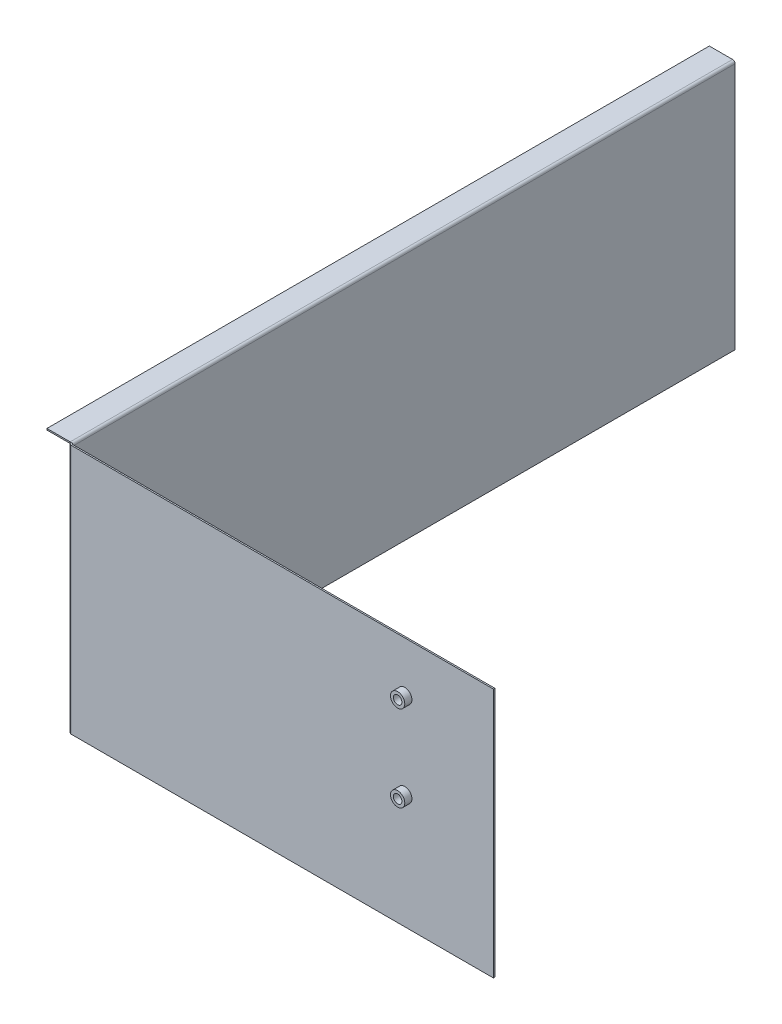
from build123d import *

# Parameters (mm, degrees)
SKETCH1_W                    = 297
SKETCH1_H                    = 175
BASE_FLANGE1_DEPTH           = 1
EDGE_FLANGE1_STRIP_W         = 5.4732
EDGE_FLANGE1_STRIP_H         = 1
EDGE_FLANGE1_STRIP_CUT_DEPTH = 175
EDGE_FLANGE1_DEPTH           = 175
EDGE_FLANGE2_STRIP_W         = 5.4732
EDGE_FLANGE2_STRIP_H         = 1
EDGE_FLANGE2_STRIP_CUT_DEPTH = 463.2634
EDGE_FLANGE2_DEPTH           = 463.2634
SKETCH17_R                   = 4.794
SKETCH17_R_2                 = 2.794
BOSS_EXTRUDE1_DEPTH          = 18
SKETCH21_R                   = 5
SKETCH21_R_2                 = 3
BOSS_EXTRUDE2_DEPTH          = 5


# Sheet-metal steps are written as plain solids
with BuildPart() as part:
    # Sketch1 → Base-Flange1 (new body)
    with BuildSketch(Plane.XY):
        Rectangle(SKETCH1_W, SKETCH1_H)
    extrude(amount=-BASE_FLANGE1_DEPTH)

    # Edge-Flange1 strip (across the edge) → Edge-Flange1 strip cut (cut)
    with BuildSketch(Plane(origin=(-148.5, -87.5, -1), x_dir=(1, 0, 0), z_dir=(0, 1, 0))):
        with Locations((-1, -0.5)):
            Rectangle(EDGE_FLANGE1_STRIP_W, EDGE_FLANGE1_STRIP_H)
    extrude(amount=EDGE_FLANGE1_STRIP_CUT_DEPTH, mode=Mode.SUBTRACT)

    # Edge-Flange1 section (across the edge) → Edge-Flange1 (add)
    with BuildSketch(Plane(origin=(-148.5, -87.5, -1), x_dir=(1, 0, 0), z_dir=(0, 1, 0))):
        with BuildLine():
            Line((0, 0.7366), (0, 464))
            Line((0, 464), (1, 464))
            Line((1, 464), (1, 0.7366))
            ThreePointArc((1, 0.7366), (1.215745145, 0.215745145), (1.7366, 0))
            Line((1.7366, 0), (1.7366, -1))
            ThreePointArc((1.7366, -1), (0.508638364, -0.491361636), (0, 0.7366))
        make_face()
    extrude(amount=EDGE_FLANGE1_DEPTH)

    # Edge-Flange2 strip (across the edge) → Edge-Flange2 strip cut (cut)
    with BuildSketch(Plane(origin=(-148.5, 87.5, -1.7366), x_dir=(0, -1, 0), z_dir=(0, 0, -1))):
        with Locations((-1, -0.5)):
            Rectangle(EDGE_FLANGE2_STRIP_W, EDGE_FLANGE2_STRIP_H)
    extrude(amount=EDGE_FLANGE2_STRIP_CUT_DEPTH, mode=Mode.SUBTRACT)

    # Edge-Flange2 section (across the edge) → Edge-Flange2 (add)
    with BuildSketch(Plane(origin=(-148.5, 87.5, -1.7366), x_dir=(0, -1, 0), z_dir=(0, 0, -1))):
        with BuildLine():
            Line((0, 0.7366), (0, 17))
            Line((0, 17), (1, 17))
            Line((1, 17), (1, 0.7366))
            ThreePointArc((1, 0.7366), (1.215745145, 0.215745145), (1.7366, 0))
            Line((1.7366, 0), (1.7366, -1))
            ThreePointArc((1.7366, -1), (0.508638364, -0.491361636), (0, 0.7366))
        make_face()
    extrude(amount=EDGE_FLANGE2_DEPTH)

    # Sketch17 → Boss-Extrude1 (add)
    # profile 1 of 4: a face of its own
    with BuildSketch(Plane.ZY.offset(148.5)):
        with Locations((-72.584668807, 78.453866984)):
            Circle(SKETCH17_R)
        with Locations((-72.584668807, 78.453866984)):
            Circle(SKETCH17_R_2, mode=Mode.SUBTRACT)
    # profile 2 of 4: a face of its own
    with BuildSketch(Plane.ZY.offset(148.5)):
        with Locations((-182.592068807, 78.453866984)):
            Circle(SKETCH17_R)
        with Locations((-182.592068807, 78.453866984)):
            Circle(SKETCH17_R_2, mode=Mode.SUBTRACT)
    # profile 3 of 4: a face of its own
    with BuildSketch(Plane.ZY.offset(148.5)):
        with Locations((-292.599468807, 78.453866984)):
            Circle(SKETCH17_R)
        with Locations((-292.599468807, 78.453866984)):
            Circle(SKETCH17_R_2, mode=Mode.SUBTRACT)
    # profile 4 of 4: a face of its own
    with BuildSketch(Plane.ZY.offset(148.5)):
        with Locations((-402.606868807, 78.453866984)):
            Circle(SKETCH17_R)
        with Locations((-402.606868807, 78.453866984)):
            Circle(SKETCH17_R_2, mode=Mode.SUBTRACT)
    extrude(amount=BOSS_EXTRUDE1_DEPTH)

    # Sketch21 → Boss-Extrude2 (add)
    # profile 1 of 2: a face of its own
    with BuildSketch(Plane.XY):
        with Locations(Location((86.5, 52.5, 0), (0, 0, 180))):
            Circle(SKETCH21_R)
        with Locations((86.5, 52.5)):
            Circle(SKETCH21_R_2, mode=Mode.SUBTRACT)
    # profile 2 of 2: a face of its own
    with BuildSketch(Plane.XY):
        with Locations(Location((86.5, -7.5, 0), (0, 0, 180))):
            Circle(SKETCH21_R)
        with Locations((86.5, -7.5)):
            Circle(SKETCH21_R_2, mode=Mode.SUBTRACT)
    extrude(amount=BOSS_EXTRUDE2_DEPTH)


solid = part.part
